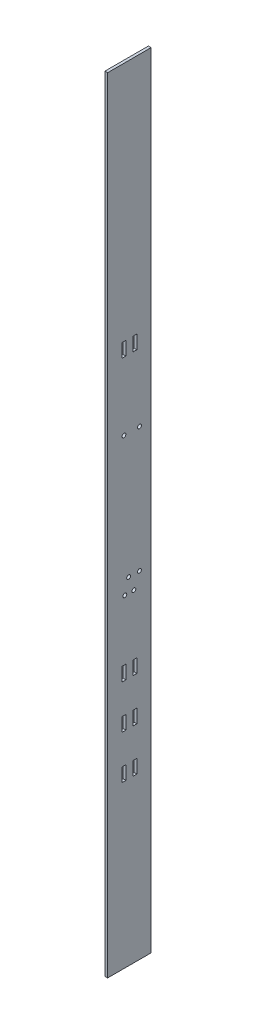
from build123d import *

# Parameters (mm, degrees)
SKETCH1_W                 = 50.8
SKETCH1_H                 = 914.4
BOSS_EXTRUDE1_DEPTH       = 3.175
SKETCH2_W                 = 4.7625
SKETCH2_H                 = 15.875
CUT_EXTRUDE1_DEPTH        = 458.916019184
LPATTERN1_COPY_1_SKETCH_W = 4.7625
LPATTERN1_COPY_1_SKETCH_H = 15.875
LPATTERN1_COPY_1_DEPTH    = 458.916019184
LPATTERN1_COPY_2_SKETCH_W = 4.7625
LPATTERN1_COPY_2_SKETCH_H = 15.875
LPATTERN1_COPY_2_DEPTH    = 458.916019184
LPATTERN1_COPY_3_SKETCH_W = 4.7625
LPATTERN1_COPY_3_SKETCH_H = 15.875
LPATTERN1_COPY_3_DEPTH    = 458.916019184
LPATTERN1_COPY_4_SKETCH_W = 4.7625
LPATTERN1_COPY_4_SKETCH_H = 15.875
LPATTERN1_COPY_4_DEPTH    = 458.916019184
LPATTERN1_COPY_5_SKETCH_W = 4.7625
LPATTERN1_COPY_5_SKETCH_H = 15.875
LPATTERN1_COPY_5_DEPTH    = 458.916019184
LPATTERN1_COPY_6_SKETCH_W = 4.7625
LPATTERN1_COPY_6_SKETCH_H = 15.875
LPATTERN1_COPY_6_DEPTH    = 458.916019184
SKETCH3_W                 = 4.7625
SKETCH3_H                 = 15.875
CUT_EXTRUDE2_DEPTH        = 458.916019184
F_8_CLEARANCE_HOLE1_D     = 4.4958


with BuildPart() as part:
    # Sketch1 → Boss-Extrude1 (new body)
    with BuildSketch(Plane(origin=(0, 0, 0), x_dir=(0, 0, -1), z_dir=(1, 0, 0))):
        Rectangle(SKETCH1_W, SKETCH1_H)
    extrude(amount=BOSS_EXTRUDE1_DEPTH)

    # Sketch2 → Cut-Extrude1 (cut, through all)
    with BuildSketch(Plane(origin=(3.175, 0, 0), x_dir=(0, 0, -1), z_dir=(1, 0, 0))):
        with Locations((6.38125, -209.55)):
            Rectangle(SKETCH2_W, SKETCH2_H)
    cut_extrude1 = extrude(amount=-CUT_EXTRUDE1_DEPTH, mode=Mode.SUBTRACT)

    # Mirror1: Cut-Extrude1 across plane
    add(cut_extrude1.mirror(Plane.XY), mode=Mode.SUBTRACT)

    # LPattern1 copy 1 sketch → LPattern1 copy 1 (cut, through all)
    with BuildSketch(Plane(origin=(3.175, -50.8, 0), x_dir=(0, 0, 1), z_dir=(1, 0, 0))):
        with Locations((6.38125, 209.55)):
            Rectangle(LPATTERN1_COPY_1_SKETCH_W, LPATTERN1_COPY_1_SKETCH_H)
    extrude(amount=-LPATTERN1_COPY_1_DEPTH, mode=Mode.SUBTRACT)

    # LPattern1 copy 2 sketch → LPattern1 copy 2 (cut, through all)
    with BuildSketch(Plane(origin=(3.175, 50.8, 0), x_dir=(0, 0, 1), z_dir=(1, 0, 0))):
        with Locations((6.38125, 209.55)):
            Rectangle(LPATTERN1_COPY_2_SKETCH_W, LPATTERN1_COPY_2_SKETCH_H)
    extrude(amount=-LPATTERN1_COPY_2_DEPTH, mode=Mode.SUBTRACT)

    # LPattern1 copy 3 sketch → LPattern1 copy 3 (cut, through all)
    with BuildSketch(Plane(origin=(3.175, 0, 0), x_dir=(0, 0, 1), z_dir=(1, 0, 0))):
        with Locations((6.38125, 209.55)):
            Rectangle(LPATTERN1_COPY_3_SKETCH_W, LPATTERN1_COPY_3_SKETCH_H)
    extrude(amount=-LPATTERN1_COPY_3_DEPTH, mode=Mode.SUBTRACT)

    # LPattern1 copy 4 sketch → LPattern1 copy 4 (cut, through all)
    with BuildSketch(Plane(origin=(3.175, -50.8, 0), x_dir=(0, 0, -1), z_dir=(1, 0, 0))):
        with Locations((6.38125, -209.55)):
            Rectangle(LPATTERN1_COPY_4_SKETCH_W, LPATTERN1_COPY_4_SKETCH_H)
    extrude(amount=-LPATTERN1_COPY_4_DEPTH, mode=Mode.SUBTRACT)

    # LPattern1 copy 5 sketch → LPattern1 copy 5 (cut, through all)
    with BuildSketch(Plane(origin=(3.175, 50.8, 0), x_dir=(0, 0, -1), z_dir=(1, 0, 0))):
        with Locations((6.38125, -209.55)):
            Rectangle(LPATTERN1_COPY_5_SKETCH_W, LPATTERN1_COPY_5_SKETCH_H)
    extrude(amount=-LPATTERN1_COPY_5_DEPTH, mode=Mode.SUBTRACT)

    # LPattern1 copy 6 sketch → LPattern1 copy 6 (cut, through all)
    with BuildSketch(Plane(origin=(3.175, 0, 0), x_dir=(0, 0, -1), z_dir=(1, 0, 0))):
        with Locations((6.38125, -209.55)):
            Rectangle(LPATTERN1_COPY_6_SKETCH_W, LPATTERN1_COPY_6_SKETCH_H)
    extrude(amount=-LPATTERN1_COPY_6_DEPTH, mode=Mode.SUBTRACT)

    # Sketch3 → Cut-Extrude2 (cut, through all)
    with BuildSketch(Plane(origin=(3.175, 0, 0), x_dir=(0, 0, -1), z_dir=(1, 0, 0))):
        with Locations((6.38125, 168.275)):
            Rectangle(SKETCH3_W, SKETCH3_H)
        with Locations((-6.38125, 168.275)):
            Rectangle(SKETCH3_W, SKETCH3_H)
    extrude(amount=-CUT_EXTRUDE2_DEPTH, mode=Mode.SUBTRACT)

    # #8 Clearance Hole1 (through all)
    with Locations(Plane(origin=(3.175, 0, 0), x_dir=(0, 0, -1), z_dir=(1, 0, 0))):
        with Locations((11.826976655, -64.523692353), (-0.873023345, -64.523692353), (11.826976655, 81.271985669), (-6.35, 81.271985669), (5.25, -80.765552879), (-5.25, -80.765552879)):
            Hole(F_8_CLEARANCE_HOLE1_D / 2)


solid = part.part
